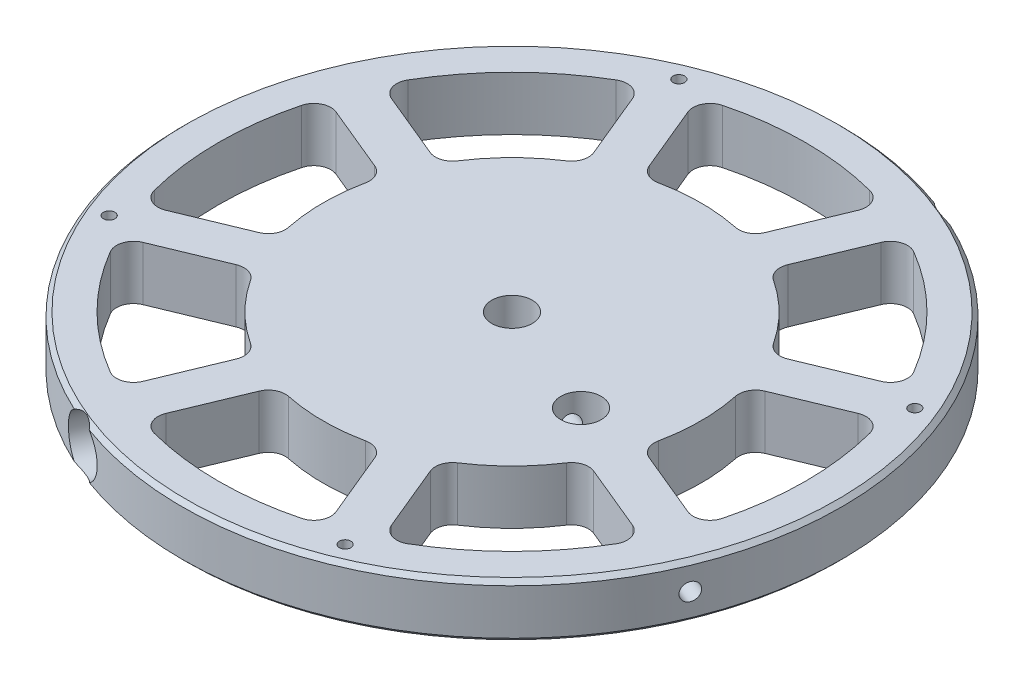
from build123d import *

# Parameters (mm, degrees)
SKETCH2_W                = 77.55
SKETCH2_H                = 12.7
F_6_32_TAPPED_HOLE2_D    = 2.7051
CIRPATTERN3_COUNT        = 4
CUT_EXTRUDE1_DEPTH       = 111.405140279
FILLET1_R                = 4
CIRPATTERN4_COUNT        = 8
FILLET1_OF_CIRPATTERN4_R = 4
CHAMFER1_SIZE            = 1
SKETCH15_W               = 2.0447
SKETCH15_H               = 101.323957926
SKETCH19_R               = 6.25
CUT_EXTRUDE3_DEPTH       = 5
CIRPATTERN5_COUNT        = 2
CIRPATTERN6_COUNT        = 2
SKETCH22_R               = 4.765
CUT_EXTRUDE4_DEPTH       = 12.8
LPATTERN1_COUNT          = 2
LPATTERN1_PITCH          = 30


with BuildPart() as part:
    # Sketch2 → Revolve1 (revolve)
    with BuildSketch(Plane(origin=(0, 0, 0), x_dir=(0, 0, -1), z_dir=(1, 0, 0))):
        with Locations((-38.775, 6.35)):
            Rectangle(SKETCH2_W, SKETCH2_H)
    revolve(axis=Axis((0, -0.75, 0), (0, 1, 0)))

    # #6-32 Tapped Hole2 (through all)
    with Locations(Plane(origin=(0, 12.7, 0), x_dir=(1, 0, 0), z_dir=(0, 1, 0))):
        with Locations((-27.763683018, 67.027460084)):
            f_6_32_tapped_hole2 = Hole(F_6_32_TAPPED_HOLE2_D / 2)

    # CirPattern3: #6-32 Tapped Hole2 ×4 about axis
    cirpattern3_axis = Axis((0, -0.75, 0), (0, 1, 0))
    for i in range(1, CIRPATTERN3_COUNT):
        add(f_6_32_tapped_hole2.rotate(cirpattern3_axis, i * 360 / CIRPATTERN3_COUNT), mode=Mode.SUBTRACT)

    # Sketch8 → Cut-Extrude1 (cut, through all)
    with BuildSketch(Plane(origin=(0, 12.7, 0), x_dir=(1, 0, 0), z_dir=(0, 1, 0))):
        with BuildLine():
            Line((-12.282922052, 42.719226653), (-21.735525784, 65.539830782))
            ThreePointArc((-21.735525784, 65.539830782), (0, 69.05), (21.735525784, 65.539830782))
            Line((21.735525784, 65.539830782), (12.282922052, 42.719226653))
            ThreePointArc((12.282922052, 42.719226653), (0, 44.45), (-12.282922052, 42.719226653))
        make_face()
    cut_extrude1 = extrude(amount=-CUT_EXTRUDE1_DEPTH, mode=Mode.SUBTRACT)

    # Fillet1
    fillet1_edges = [part.edges().sort_by_distance(p)[0] for p in [
        (12.282922052, 6.35, -42.719226653),
        (21.735525784, 6.35, -65.539830782),
        (-12.282922052, 6.35, -42.719226653),
        (-21.735525784, 6.35, -65.539830782),
    ]]
    fillet(fillet1_edges, radius=FILLET1_R)

    # CirPattern4: Cut-Extrude1 ×8 about axis
    cirpattern4_axis = Axis((0, -0.75, 0), (0, 1, 0))
    for i in range(1, CIRPATTERN4_COUNT):
        add(cut_extrude1.rotate(cirpattern4_axis, i * 360 / CIRPATTERN4_COUNT), mode=Mode.SUBTRACT)

    # Fillet1 of CirPattern4
    fillet1_of_cirpattern4_edges = [part.edges().sort_by_distance(p)[0] for p in [
        (-21.521717378, 6.35, -38.89239233),
        (-30.974321109, 6.35, -61.712996458),
        (-38.89239233, 6.35, -21.521717378),
        (-61.712996458, 6.35, -30.974321109),
        (-42.719226653, 6.35, -12.282922052),
        (-65.539830782, 6.35, -21.735525784),
        (-42.719226653, 6.35, 12.282922052),
        (-65.539830782, 6.35, 21.735525784),
        (-38.89239233, 6.35, 21.521717378),
        (-61.712996458, 6.35, 30.974321109),
        (-21.521717378, 6.35, 38.89239233),
        (-30.974321109, 6.35, 61.712996458),
        (-12.282922052, 6.35, 42.719226653),
        (-21.735525784, 6.35, 65.539830782),
        (12.282922052, 6.35, 42.719226653),
        (21.735525784, 6.35, 65.539830782),
        (21.521717378, 6.35, 38.89239233),
        (30.974321109, 6.35, 61.712996458),
        (38.89239233, 6.35, 21.521717378),
        (61.712996458, 6.35, 30.974321109),
        (42.719226653, 6.35, 12.282922052),
        (65.539830782, 6.35, 21.735525784),
        (42.719226653, 6.35, -12.282922052),
        (65.539830782, 6.35, -21.735525784),
        (38.89239233, 6.35, -21.521717378),
        (61.712996458, 6.35, -30.974321109),
        (21.521717378, 6.35, -38.89239233),
        (30.974321109, 6.35, -61.712996458),
    ]]
    fillet(fillet1_of_cirpattern4_edges, radius=FILLET1_OF_CIRPATTERN4_R)

    # Chamfer1
    chamfer1_edges = [part.edges().sort_by_distance(p)[0] for p in [
        (0, 0, -77.55),
        (0, 12.7, -77.55),
    ]]
    chamfer(chamfer1_edges, length=CHAMFER1_SIZE)

    # Sketch15 → #20 (0.161) Diameter Hole1 (revolve, cut)
    with BuildSketch(Plane(origin=(0, 6.35, 0), x_dir=(-0.38268343236508734, 0, 0.9238795325112877), z_dir=(0, 1, 0))):
        with Locations((1.02235, 50.661978963)):
            Rectangle(SKETCH15_W, SKETCH15_H)
    revolve(axis=Axis((-5.866635031, 6.35, -2.430039796), (0.9238795325112877, 0, 0.3826834323650874)), mode=Mode.SUBTRACT)

    # Sketch19 → Cut-Extrude3 (cut)
    with BuildSketch(Plane(origin=(29.67710018, 0, -71.646857746), x_dir=(-0.9238795325112891, 0, -0.38268343236508423), z_dir=(0.38268343236508423, 0, -0.9238795325112891))):
        with Locations((0, 6.35)):
            Circle(SKETCH19_R)
    cut_extrude3 = extrude(amount=-CUT_EXTRUDE3_DEPTH, mode=Mode.SUBTRACT)

    # CirPattern5: Cut-Extrude3 ×2 about axis
    cirpattern5_axis = Axis((0, -0.75, 0), (0, 1, 0))
    for i in range(1, CIRPATTERN5_COUNT):
        add(cut_extrude3.rotate(cirpattern5_axis, i * 360 / CIRPATTERN5_COUNT), mode=Mode.SUBTRACT)

    # Sketch21 → #10-24 Tapped Hole1 (revolve, cut)
    with BuildSketch(Plane(origin=(-27.763683018, 6.35, 67.027460084), x_dir=(0.9238795325112891, 0, 0.38268343236508423), z_dir=(0, 1, 0))):
        Polygon((0, 0), (0, 51.940824014), (1.89865, 50.8), (1.89865, 0), align=None)
    f_10_24_tapped_hole1 = revolve(axis=Axis((-30.193722814, 6.35, 72.894095115), (0.38268343236508423, 0, -0.923879532511289)), mode=Mode.SUBTRACT)

    # CirPattern6: #10-24 Tapped Hole1 ×2 about axis
    cirpattern6_axis = Axis((0, -0.75, 0), (0, 1, 0))
    for i in range(1, CIRPATTERN6_COUNT):
        add(f_10_24_tapped_hole1.rotate(cirpattern6_axis, i * 360 / CIRPATTERN6_COUNT), mode=Mode.SUBTRACT)

    # Sketch22 → Cut-Extrude4 (cut)
    with BuildSketch(Plane(origin=(0, 12.7, 0), x_dir=(1, 0, 0), z_dir=(0, 1, 0))):
        Circle(SKETCH22_R)
    cut_extrude4 = extrude(amount=-CUT_EXTRUDE4_DEPTH, mode=Mode.SUBTRACT)

    # LPattern1: Cut-Extrude4 ×2
    with Locations(*[Vector(0.9238795325112866, 0, 0.38268343236509034) * (i * LPATTERN1_PITCH) for i in range(1, LPATTERN1_COUNT)]):
        add(cut_extrude4, mode=Mode.SUBTRACT)


solid = part.part
